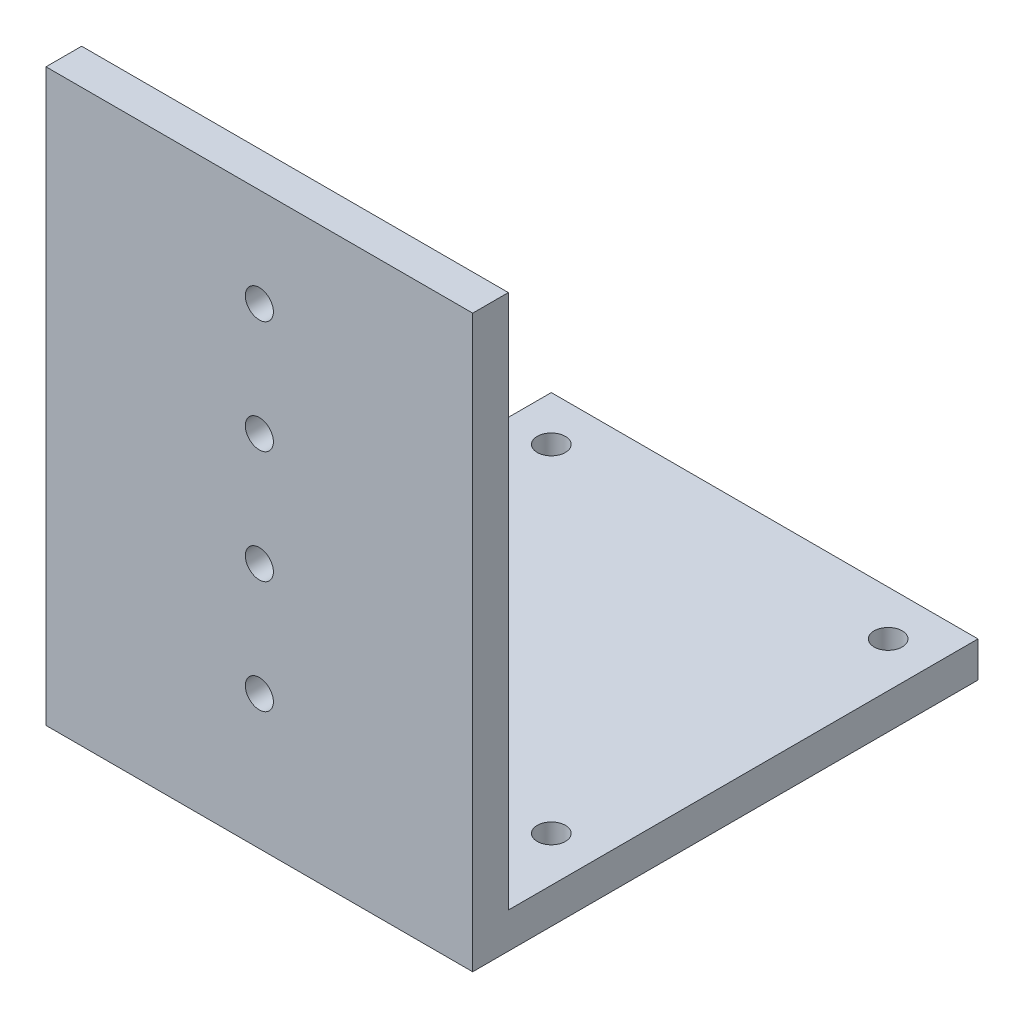
from build123d import *

# Parameters (mm, degrees)
SKETCH1_W            = 38
SKETCH1_H            = 45
BOSS_EXTRUDE1_DEPTH  = 3.175
SKETCH2_W            = 38
SKETCH2_H            = 3.175
BOSS_EXTRUDE2_DEPTH  = 47.625
SKETCH3_R            = 1.25
CAMERA_HOLES_DEPTH   = 10
SKETCH4_R            = 1.25
MOUNTING_HOLES_DEPTH = 10


with BuildPart() as part:
    # Sketch1 → Boss-Extrude1 (new body)
    with BuildSketch(Plane(origin=(0, 0, 0), x_dir=(1, 0, 0), z_dir=(0, 1, 0))):
        with Locations((19, -22.5)):
            Rectangle(SKETCH1_W, SKETCH1_H)
    extrude(amount=BOSS_EXTRUDE1_DEPTH)

    # Sketch2 → Boss-Extrude2 (add)
    with BuildSketch(Plane(origin=(0, 3.175, 0), x_dir=(1, 0, 0), z_dir=(0, 1, 0))):
        with Locations((19, -43.4125)):
            Rectangle(SKETCH2_W, SKETCH2_H)
    extrude(amount=BOSS_EXTRUDE2_DEPTH)

    # Sketch3 → camera holes (cut)
    with BuildSketch(Plane.XZ):
        with Locations((4, 34)):
            Circle(SKETCH3_R)
        with Locations((34, 34)):
            Circle(SKETCH3_R)
        with Locations((4, 4)):
            Circle(SKETCH3_R)
        with Locations((34, 4)):
            Circle(SKETCH3_R)
    extrude(amount=-CAMERA_HOLES_DEPTH, mode=Mode.SUBTRACT)

    # Sketch4 → mounting holes (cut)
    with BuildSketch(Plane.XY.offset(45)):
        with Locations((19, 42.025)):
            Circle(SKETCH4_R)
        with Locations((19, 11.95)):
            Circle(SKETCH4_R)
        with Locations((19, 32)):
            Circle(SKETCH4_R)
        with Locations((19, 21.975)):
            Circle(SKETCH4_R)
    extrude(amount=-MOUNTING_HOLES_DEPTH, mode=Mode.SUBTRACT)


solid = part.part
